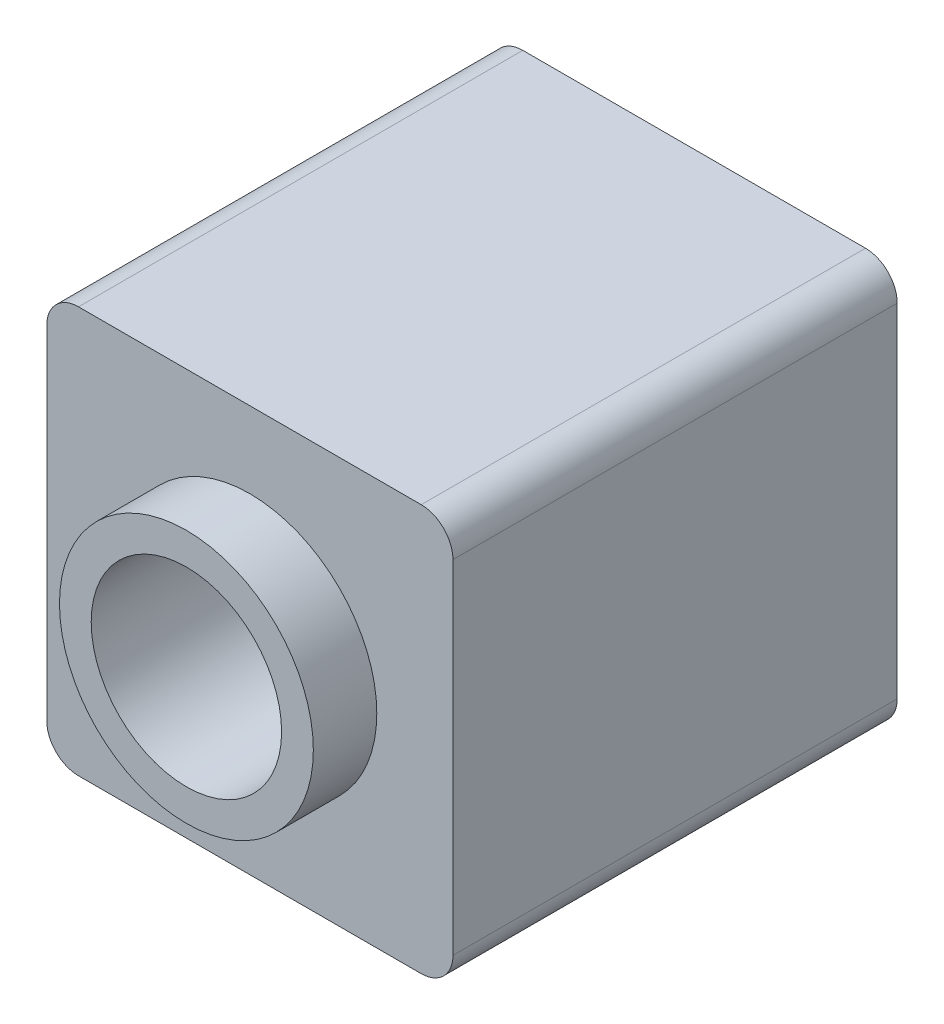
from build123d import *

# Parameters (mm, degrees)
SKETCH2_R           = 1.5
BOSS_EXTRUDE1_DEPTH = 8
SKETCH3_R           = 2
CUT_EXTRUDE1_DEPTH  = 1
SKETCH4_R           = 2.4
CUT_EXTRUDE2_DEPTH  = 4


with BuildPart() as part:
    # Sketch2 → Boss-Extrude1 (new body)
    with BuildSketch(Plane(origin=(0, 0, -57.465471353), x_dir=(-1, 0, 0), z_dir=(0, 0, -1))):
        with BuildLine():
            Line((-6.440457264, -35.028386779), (-1.040457264, -35.028386779))
            ThreePointArc((-1.040457264, -35.028386779), (-0.686903873, -34.881940169), (-0.540457264, -34.528386779))
            Line((-0.540457264, -34.528386779), (-0.540457264, -29.128386779))
            ThreePointArc((-0.540457264, -29.128386779), (-0.686903873, -28.774833388), (-1.040457264, -28.628386779))
            Line((-1.040457264, -28.628386779), (-6.440457264, -28.628386779))
            ThreePointArc((-6.440457264, -28.628386779), (-6.794010654, -28.774833388), (-6.940457264, -29.128386779))
            Line((-6.940457264, -29.128386779), (-6.940457264, -34.528386779))
            ThreePointArc((-6.940457264, -34.528386779), (-6.794010654, -34.881940169), (-6.440457264, -35.028386779))
        make_face()
        with Locations((-3.740457264, -31.828386779)):
            Circle(SKETCH2_R, mode=Mode.SUBTRACT)
    extrude(amount=BOSS_EXTRUDE1_DEPTH)

    # Sketch3 → Cut-Extrude1 (cut)
    with BuildSketch(Plane(origin=(0, 0, -57.465471353), x_dir=(-1, 0, 0), z_dir=(0, 0, -1))):
        with BuildLine():
            Line((-1.040457264, -28.628386779), (-6.440457264, -28.628386779))
            ThreePointArc((-6.440457264, -28.628386779), (-6.794010654, -28.774833388), (-6.940457264, -29.128386779))
            Line((-6.940457264, -29.128386779), (-6.940457264, -34.528386779))
            ThreePointArc((-6.940457264, -34.528386779), (-6.794010654, -34.881940169), (-6.440457264, -35.028386779))
            Line((-6.440457264, -35.028386779), (-1.040457264, -35.028386779))
            ThreePointArc((-1.040457264, -35.028386779), (-0.686903873, -34.881940169), (-0.540457264, -34.528386779))
            Line((-0.540457264, -34.528386779), (-0.540457264, -29.128386779))
            ThreePointArc((-0.540457264, -29.128386779), (-0.686903873, -28.774833388), (-1.040457264, -28.628386779))
        make_face()
        with Locations((-3.740457264, -31.828386779)):
            Circle(SKETCH3_R, mode=Mode.SUBTRACT)
    extrude(amount=CUT_EXTRUDE1_DEPTH, mode=Mode.SUBTRACT)

    # Sketch4 → Cut-Extrude2 (cut)
    with BuildSketch(Plane(origin=(0, 0, -65.465471353), x_dir=(-1, 0, 0), z_dir=(0, 0, -1))):
        with Locations((-3.740457264, -31.828386779)):
            Circle(SKETCH4_R)
    extrude(amount=-CUT_EXTRUDE2_DEPTH, mode=Mode.SUBTRACT)


solid = part.part
